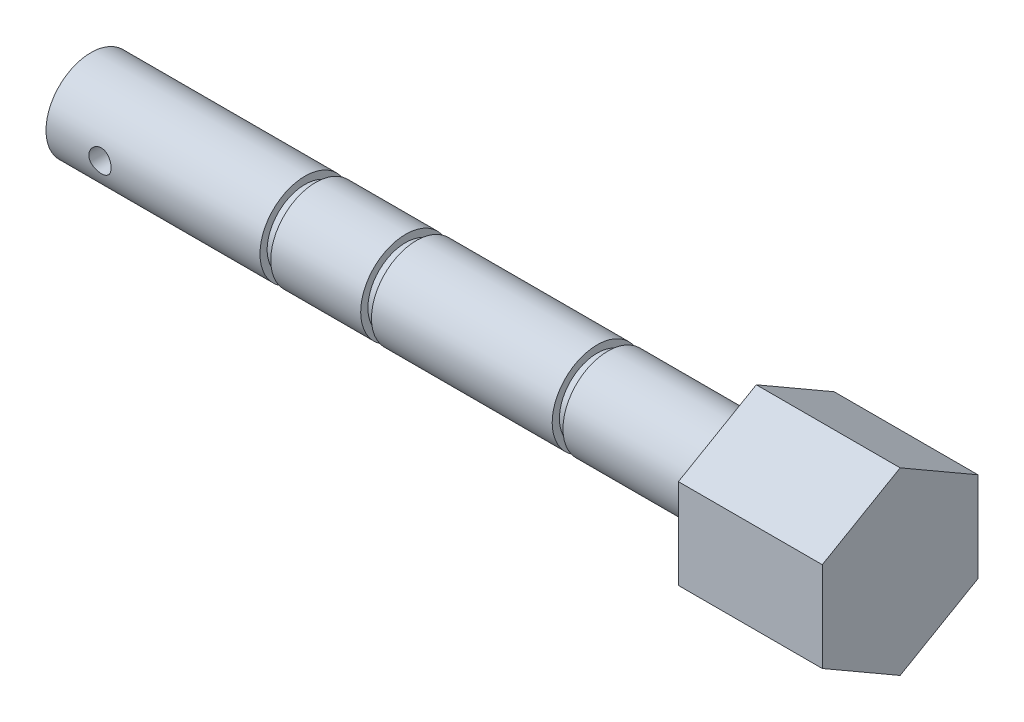
from build123d import *

# Parameters (mm, degrees)
SKETCH1_R           = 3.175
BOSS_EXTRUDE2_DEPTH = 46.99
BOSS_EXTRUDE3_DEPTH = 10.16
SKETCH3_R           = 3.175
SKETCH3_R_2         = 1.778
CUT_EXTRUDE1_DEPTH  = 19.05
SKETCH6_R           = 3.175
BOSS_EXTRUDE5_DEPTH = 49.022
CUT_EXTRUDE5_DEPTH  = 20.32
SKETCH9_R           = 0.866025404
CUT_EXTRUDE7_DEPTH  = 20.32
SKETCH10_R          = 0.7874
CUT_EXTRUDE8_DEPTH  = 5.334
CUT_EXTRUDE9_START  = 0.762
SKETCH11_R          = 3.175
SKETCH11_R_2        = 2.667
CUT_EXTRUDE9_DEPTH  = 0.762
CUT_EXTRUDE10_START = 0.762
SKETCH12_R          = 3.175
SKETCH12_R_2        = 2.667
CUT_EXTRUDE10_DEPTH = 0.762
CUT_EXTRUDE12_START = 0.762
SKETCH13_R          = 3.175
SKETCH13_R_2        = 2.667
CUT_EXTRUDE12_DEPTH = 0.762


with BuildPart() as part:
    # Sketch1 → Boss-Extrude2 (new body)
    with BuildSketch(Plane(origin=(0, 0, 0), x_dir=(0, 0, -1), z_dir=(1, 0, 0))):
        Circle(SKETCH1_R)
    extrude(amount=BOSS_EXTRUDE2_DEPTH)

    # Sketch2 → Boss-Extrude3 (add)
    with BuildSketch(Plane(origin=(46.99, 0, 0), x_dir=(0, 0, -1), z_dir=(1, 0, 0))):
        Polygon((-5.499261314, 3.175), (-5.499261314, -3.175), (0, -6.35), (5.499261314, -3.175), (5.499261314, 3.175), (0, 6.35), align=None)
    extrude(amount=BOSS_EXTRUDE3_DEPTH)

    # Sketch3 → Cut-Extrude1 (cut)
    with BuildSketch(Plane.ZY):
        Circle(SKETCH3_R)
        Circle(SKETCH3_R_2, mode=Mode.SUBTRACT)
    extrude(amount=-CUT_EXTRUDE1_DEPTH, mode=Mode.SUBTRACT)

    # Sketch6 → Boss-Extrude5 (add)
    with BuildSketch(Plane.ZY):
        Circle(SKETCH6_R)
    extrude(amount=-BOSS_EXTRUDE5_DEPTH)

    # Sketch7 → Cut-Extrude5 (cut)
    with BuildSketch(Plane.ZY):
        Polygon((-0.489261374, 0.714579112), (-0.863474351, -0.066423223), (-0.374212977, -0.781002335), (0.489261374, -0.714579112), (0.863474351, 0.066423223), (0.374212977, 0.781002335), align=None)
    extrude(amount=-CUT_EXTRUDE5_DEPTH, mode=Mode.SUBTRACT)

    # Sketch9 → Cut-Extrude7 (cut)
    with BuildSketch(Plane.ZY):
        Circle(SKETCH9_R)
    extrude(amount=-CUT_EXTRUDE7_DEPTH, mode=Mode.SUBTRACT)

    # Sketch10 → Cut-Extrude8 (cut)
    with BuildSketch(Plane.XY.offset(5.499261314)):
        with Locations((3.81, 0)):
            Circle(SKETCH10_R)
    extrude(amount=-CUT_EXTRUDE8_DEPTH, mode=Mode.SUBTRACT)

    # Sketch11 → Cut-Extrude9 (cut)
    with BuildSketch(Plane.ZY.offset(-36.5125).offset(CUT_EXTRUDE9_START)):
        Circle(SKETCH11_R)
        Circle(SKETCH11_R_2, mode=Mode.SUBTRACT)
    extrude(amount=-CUT_EXTRUDE9_DEPTH, mode=Mode.SUBTRACT)

    # Sketch12 → Cut-Extrude10 (cut)
    with BuildSketch(Plane.ZY.offset(-15.875).offset(CUT_EXTRUDE10_START)):
        Circle(SKETCH12_R)
        Circle(SKETCH12_R_2, mode=Mode.SUBTRACT)
    extrude(amount=-CUT_EXTRUDE10_DEPTH, mode=Mode.SUBTRACT)

    # Sketch13 → Cut-Extrude12 (cut)
    with BuildSketch(Plane.ZY.offset(-22.987).offset(CUT_EXTRUDE12_START)):
        Circle(SKETCH13_R)
        Circle(SKETCH13_R_2, mode=Mode.SUBTRACT)
    extrude(amount=-CUT_EXTRUDE12_DEPTH, mode=Mode.SUBTRACT)


solid = part.part
